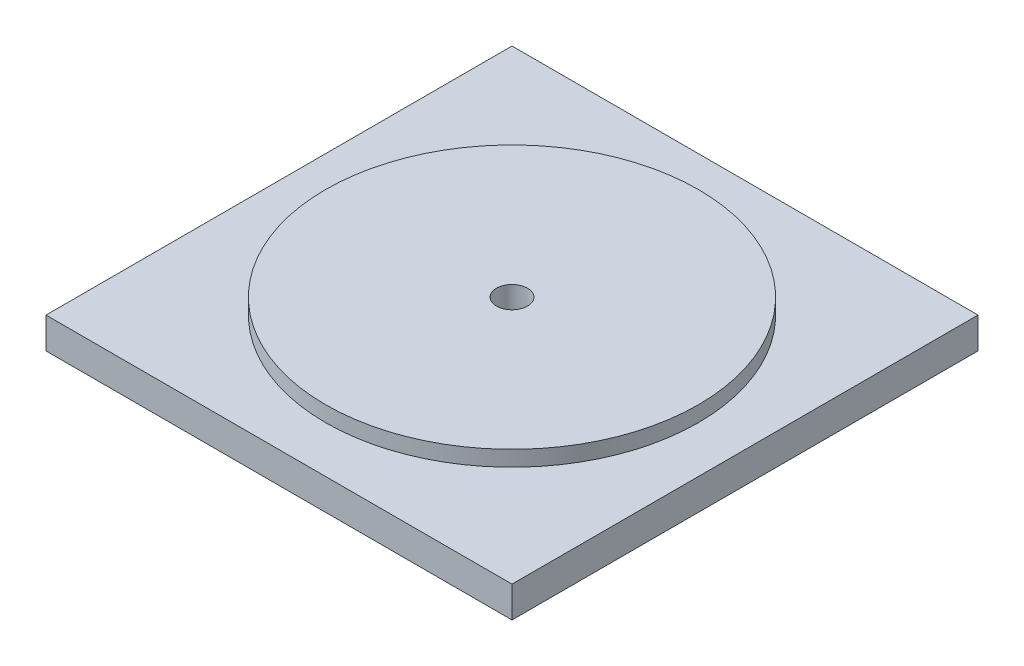
from build123d import *

# Parameters (mm, degrees)
SKETCH1_W           = 150
SKETCH1_H           = 150
BOSS_EXTRUDE1_DEPTH = 10
SKETCH2_R           = 60
BOSS_EXTRUDE2_DEPTH = 5
SKETCH3_R           = 5
CUT_EXTRUDE1_DEPTH  = 108.121426428


with BuildPart() as part:
    # Sketch1 → Boss-Extrude1 (new body)
    with BuildSketch(Plane(origin=(0, 0, 0), x_dir=(1, 0, 0), z_dir=(0, 1, 0))):
        Rectangle(SKETCH1_W, SKETCH1_H)
    extrude(amount=-BOSS_EXTRUDE1_DEPTH)

    # Sketch2 → Boss-Extrude2 (add)
    with BuildSketch(Plane(origin=(0, 0, 0), x_dir=(1, 0, 0), z_dir=(0, 1, 0))):
        Circle(SKETCH2_R)
    extrude(amount=BOSS_EXTRUDE2_DEPTH)

    # Sketch3 → Cut-Extrude1 (cut, through all)
    with BuildSketch(Plane(origin=(0, 5, 0), x_dir=(1, 0, 0), z_dir=(0, 1, 0))):
        Circle(SKETCH3_R)
    extrude(amount=-CUT_EXTRUDE1_DEPTH, mode=Mode.SUBTRACT)


solid = part.part
